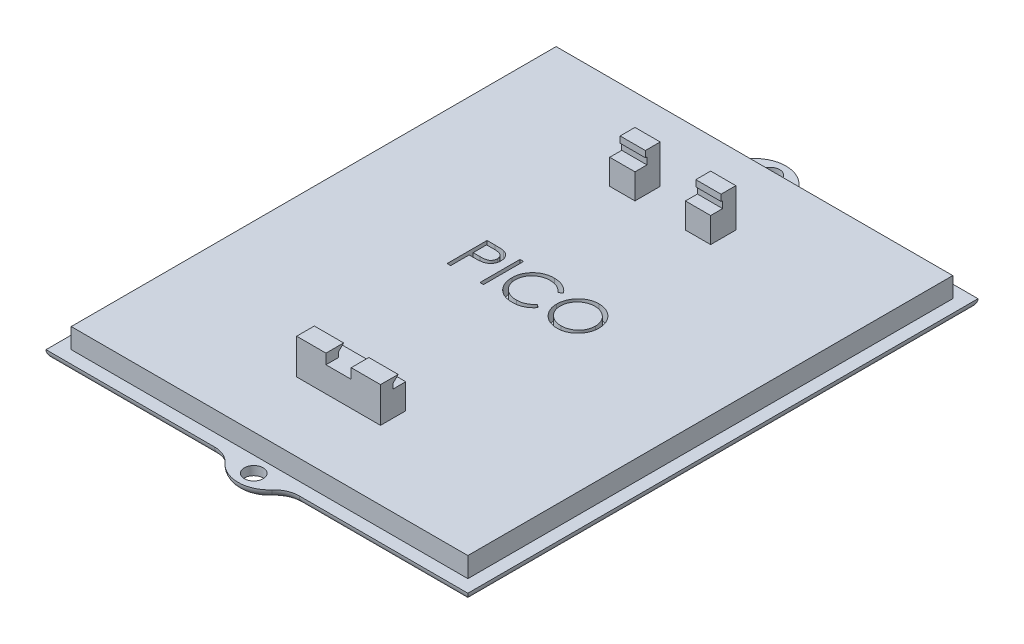
from build123d import *

# Parameters (mm, degrees)
SKETCH1_W            = 62.9
SKETCH1_H            = 76.9
BOSS_EXTRUDE1_DEPTH  = 4.575
SKETCH11_W           = 66.9
SKETCH11_H           = 80.9
BOSS_EXTRUDE5_DEPTH  = 1.4
BOSS_EXTRUDE3_DEPTH  = 1.4
CUT_EXTRUDE3_REACH   = 56.926
SKETCH12_R           = 1.5
FILLET1_R            = 1.4
SKETCH15_W           = 13.3
SKETCH15_H           = 4
SKETCH15_W_2         = 4
BOSS_EXTRUDE7_DEPTH  = 4
SKETCH16_W           = 4.65
SKETCH16_H           = 2
BOSS_EXTRUDE8_DEPTH  = 0.8
BOSS_EXTRUDE9_DEPTH  = 4.65
SKETCH18_W           = 4
SKETCH18_H           = 2.1
BOSS_EXTRUDE10_DEPTH = 1.1
SKETCH5_W            = 0.569871795
SKETCH5_H            = 6.35
LETTERS_DEPTH        = 2
SKETCH21_W           = 4
SKETCH21_H           = 2.35
BOSS_EXTRUDE11_DEPTH = 1


with BuildPart() as part:
    # Sketch1 → Boss-Extrude1 (new body)
    with BuildSketch(Plane(origin=(0, 0, 0), x_dir=(1, 0, 0), z_dir=(0, 1, 0))):
        Rectangle(SKETCH1_W, SKETCH1_H)
    extrude(amount=BOSS_EXTRUDE1_DEPTH)

    # Sketch11 → Boss-Extrude5 (add)
    with BuildSketch(Plane(origin=(0, 0, 0), x_dir=(-1, 0, 0), z_dir=(0, -1, 0))):
        Rectangle(SKETCH11_W, SKETCH11_H)
    extrude(amount=-BOSS_EXTRUDE5_DEPTH)

    # Sketch4 → Boss-Extrude3 (add)
    with BuildSketch(Plane(origin=(0, 0, 0), x_dir=(1, 0, 0), z_dir=(0, 1, 0))):
        with BuildLine():
            Line((-6.708203932, -40.45), (6.708203932, -40.45))
            ThreePointArc((6.708203932, -40.45), (5.075210771, -40.798516283), (3.726779962, -41.783333333))
            ThreePointArc((3.726779962, -41.783333333), (0, -43.45), (-3.726779962, -41.783333333))
            ThreePointArc((-3.726779962, -41.783333333), (-5.075210771, -40.798516283), (-6.708203932, -40.45))
        make_face()
    boss_extrude3 = extrude(amount=BOSS_EXTRUDE3_DEPTH)

    # Sketch12 → Cut-Extrude3 (cut, up to next)
    with BuildSketch(Plane(origin=(0, 1.4, 0), x_dir=(1, 0, 0), z_dir=(0, 1, 0)), mode=Mode.PRIVATE) as cut_extrude3_sk1:
        with Locations(Location((0, -40.95, 0), (0, 0, 270))):
            Circle(SKETCH12_R)
    cut_extrude3_tool1 = extrude(cut_extrude3_sk1.sketch, amount=-CUT_EXTRUDE3_REACH, mode=Mode.PRIVATE) & part.part
    cut_extrude3 = cut_extrude3_tool1.solids().sort_by_distance((0, 1.4, 40.95))[0]
    add(cut_extrude3, mode=Mode.SUBTRACT)

    # Mirror1: Boss-Extrude3, Cut-Extrude3 across plane
    add(boss_extrude3.mirror(Plane.XY))
    add(cut_extrude3.mirror(Plane.XY), mode=Mode.SUBTRACT)

    # Fillet1
    # the kernel refuses this fillet: 1.4 mm, written as the material it takes off along each edge
    with BuildSketch(Plane(origin=(6.708203932, 0, -40.45), x_dir=(0, 0, 1), z_dir=(1, 0, 0)), Plane(origin=(-36.95, 0, -40.45), x_dir=(0, 0, 1), z_dir=(1, 0, 0)), Plane(origin=(-6.708203932, 0, 40.45), x_dir=(0, 0, -1), z_dir=(-1, 0, 0)), Plane(origin=(36.95, 0, 40.45), x_dir=(0, 0, -1), z_dir=(-1, 0, 0))) as fillet1_piece_1:
        with BuildLine():
            CenterArc((FILLET1_R, -FILLET1_R), FILLET1_R, 90, 90)
            Line((0, -FILLET1_R), (0, 0))
            Line((0, 0), (FILLET1_R, 0))
        make_face()
    extrude(amount=30.241796068, mode=Mode.SUBTRACT)
    with BuildSketch(Plane(origin=(6.708203932, 0, -44.45), x_dir=(0, 0, 1), z_dir=(1, 0, 0))) as fillet1_piece_2:
        with BuildLine():
            CenterArc((4 + FILLET1_R, -FILLET1_R), FILLET1_R, 90, 90)
            Line((4, -FILLET1_R), (4, 0))
            Line((4, 0), (4 + FILLET1_R, 0))
        make_face()
    revolve(axis=Axis((6.708203932, 0, -44.45), (0, -1, 0)), revolution_arc=48.189685104, mode=Mode.SUBTRACT)
    with BuildSketch(Plane(origin=(0, 0, -38.45), x_dir=(0.7453559924999297, 0, -0.6666666666666671), z_dir=(0.6666666666666671, 0, 0.7453559924999297))) as fillet1_piece_3:
        with BuildLine():
            CenterArc((5 - FILLET1_R, FILLET1_R), FILLET1_R, 270, 90)
            Line((5, FILLET1_R), (5, 0))
            Line((5, 0), (5 - FILLET1_R, 0))
        make_face()
    revolve(axis=Axis((0, 0, -38.45), (0, 1, 0)), revolution_arc=96.379370208, mode=Mode.SUBTRACT)
    with BuildSketch(Plane(origin=(-6.708203932, 0, -44.45), x_dir=(0.7453559924999316, 0, 0.666666666666665), z_dir=(0.666666666666665, 0, -0.7453559924999316))) as fillet1_piece_4:
        with BuildLine():
            CenterArc((4 + FILLET1_R, -FILLET1_R), FILLET1_R, 90, 90)
            Line((4, -FILLET1_R), (4, 0))
            Line((4, 0), (4 + FILLET1_R, 0))
        make_face()
    revolve(axis=Axis((-6.708203932, 0, -44.45), (0, -1, 0)), revolution_arc=48.189685104, mode=Mode.SUBTRACT)
    with BuildSketch(Plane(origin=(-33.45, 0, 43.95), x_dir=(1, 0, 0), z_dir=(0, 0, -1)), Plane(origin=(33.45, 0, -43.95), x_dir=(-1, 0, 0), z_dir=(0, 0, 1))) as fillet1_piece_5:
        with BuildLine():
            CenterArc((FILLET1_R, -FILLET1_R), FILLET1_R, 90, 90)
            Line((0, -FILLET1_R), (0, 0))
            Line((0, 0), (FILLET1_R, 0))
        make_face()
    extrude(amount=87.9, mode=Mode.SUBTRACT)
    with BuildSketch(Plane(origin=(-6.708203932, 0, 44.45), x_dir=(0.7453559924999316, 0, -0.666666666666665), z_dir=(0.666666666666665, 0, 0.7453559924999316))) as fillet1_piece_6:
        with BuildLine():
            CenterArc((4 + FILLET1_R, FILLET1_R), FILLET1_R, 180, 90)
            Line((4, FILLET1_R), (4, 0))
            Line((4, 0), (4 + FILLET1_R, 0))
        make_face()
    revolve(axis=Axis((-6.708203932, 0, 44.45), (0, 1, 0)), revolution_arc=48.189685104, mode=Mode.SUBTRACT)
    with BuildSketch(Plane(origin=(0, 0, 38.45), x_dir=(0.7453559924999297, 0, 0.6666666666666671), z_dir=(0.6666666666666671, 0, -0.7453559924999297))) as fillet1_piece_7:
        with BuildLine():
            CenterArc((5 - FILLET1_R, -FILLET1_R), FILLET1_R, 0, 90)
            Line((5, -FILLET1_R), (5, 0))
            Line((5, 0), (5 - FILLET1_R, 0))
        make_face()
    revolve(axis=Axis((0, 0, 38.45), (0, -1, 0)), revolution_arc=96.379370208, mode=Mode.SUBTRACT)
    with BuildSketch(Plane(origin=(6.708203932, 0, 44.45), x_dir=(0, 0, -1), z_dir=(1, 0, 0))) as fillet1_piece_8:
        with BuildLine():
            CenterArc((4 + FILLET1_R, FILLET1_R), FILLET1_R, 180, 90)
            Line((4, FILLET1_R), (4, 0))
            Line((4, 0), (4 + FILLET1_R, 0))
        make_face()
    revolve(axis=Axis((6.708203932, 0, 44.45), (0, 1, 0)), revolution_arc=48.189685104, mode=Mode.SUBTRACT)

    # Sketch15 → Boss-Extrude7 (add)
    with BuildSketch(Plane(origin=(0, 4.575, 0), x_dir=(1, 0, 0), z_dir=(0, 1, 0))):
        with Locations((0, -25.5)):
            Rectangle(SKETCH15_W, SKETCH15_H)
        with Locations((-6, 25.5)):
            Rectangle(SKETCH15_W_2, SKETCH15_H)
        with Locations((6, 25.5)):
            Rectangle(SKETCH15_W_2, SKETCH15_H)
    extrude(amount=BOSS_EXTRUDE7_DEPTH)

    # Sketch16 → Boss-Extrude8 (add)
    with BuildSketch(Plane(origin=(0, 8.575, 0), x_dir=(1, 0, 0), z_dir=(0, 1, 0))):
        with Locations((-4.325, -26.5)):
            Rectangle(SKETCH16_W, SKETCH16_H)
    boss_extrude8 = extrude(amount=BOSS_EXTRUDE8_DEPTH)

    # Sketch17 → Boss-Extrude9 (add)
    with BuildSketch(Plane.ZY.offset(6.65)):
        Polygon((27.5, 9.375), (27.5, 10.175), (24.7, 10.175), (25.5, 9.375), align=None)
    boss_extrude9 = extrude(amount=-BOSS_EXTRUDE9_DEPTH)

    # Mirror4: Boss-Extrude8, Boss-Extrude9 across plane
    add(boss_extrude8.mirror(Plane(origin=(0, 0, 0), x_dir=(0, 0, 1), z_dir=(1, 0, 0))))
    add(boss_extrude9.mirror(Plane(origin=(0, 0, 0), x_dir=(0, 0, 1), z_dir=(1, 0, 0))))

    # Sketch18 → Boss-Extrude10 (add)
    with BuildSketch(Plane(origin=(0, 8.575, 0), x_dir=(1, 0, 0), z_dir=(0, 1, 0))):
        with Locations((6, 26.45)):
            Rectangle(SKETCH18_W, SKETCH18_H)
        with Locations((-6, 26.45)):
            Rectangle(SKETCH18_W, SKETCH18_H)
    extrude(amount=BOSS_EXTRUDE10_DEPTH)

    # Sketch5 → Letters (cut)
    # profile 1 of 4: a face of its own
    with BuildSketch(Plane(origin=(0, 4.575, 0), x_dir=(1, 0, 0), z_dir=(0, 1, 0))):
        with BuildLine():
            Line((-10.298397436, 6.35), (-9.05307492, 6.35))
            add(Edge.make_bspline(
                [(-9.05307492, 6.35), (-8.967420847, 6.349905845), (-8.80330384, 6.349725441), (-8.567963668, 6.344255831), (-8.354223155, 6.336950261), (-8.162543178, 6.326823112), (-7.992333971, 6.314855012), (-7.844365728, 6.298069169), (-7.71747539, 6.280542633), (-7.641445117, 6.262723796), (-7.606770833, 6.254597356)],
                knots=[0, 0, 0, 0, 1.415646017, 2.712440637, 3.8905458, 4.950247383, 5.884950622, 6.709939814, 7.411656543, 8, 8, 8, 8], degree=3))
            add(Edge.make_bspline(
                [(-7.606770833, 6.254597356), (-7.562876851, 6.242583247), (-7.476123192, 6.218838126), (-7.351117014, 6.171278942), (-7.232183608, 6.114887014), (-7.118914924, 6.050617866), (-7.012702859, 5.975714057), (-6.911962756, 5.893211922), (-6.817583649, 5.801206647), (-6.730096266, 5.700730162), (-6.649750991, 5.59346921), (-6.580572852, 5.477822593), (-6.52264774, 5.355736942), (-6.472966662, 5.227297177), (-6.437209895, 5.091424733), (-6.410273376, 4.949063698), (-6.393176224, 4.800229332), (-6.391538719, 4.698520715), (-6.390705128, 4.646744792)],
                knots=[0, 0, 0, 0, 0.999701418, 1.975846123, 2.934577507, 3.890451536, 4.834027766, 5.787354733, 6.749476667, 7.726910423, 8.712836071, 9.690891519, 10.682875813, 11.679750201, 12.712814741, 13.765529915, 14.8625177, 16, 16, 16, 16], degree=3))
            add(Edge.make_bspline(
                [(-6.390705128, 4.646744792), (-6.391469713, 4.594533682), (-6.392965675, 4.492379121), (-6.410920364, 4.342931348), (-6.43510514, 4.200113697), (-6.47229265, 4.064242837), (-6.520998371, 3.936125653), (-6.578133952, 3.813804275), (-6.647046929, 3.699359728), (-6.72623112, 3.592376529), (-6.814317584, 3.492754259), (-6.910933629, 3.401214846), (-7.015689202, 3.318294118), (-7.128251385, 3.24380618), (-7.24971754, 3.179478359), (-7.378245447, 3.121861534), (-7.514952268, 3.07347261), (-7.609553686, 3.04801807), (-7.657652244, 3.035076122)],
                knots=[0, 0, 0, 0, 1.121902311, 2.195077645, 3.232258892, 4.234102512, 5.217864754, 6.176164875, 7.132989551, 8.084763148, 9.034132444, 9.988522005, 10.94243251, 11.903244335, 12.886203696, 13.894208494, 14.929344452, 16, 16, 16, 16], degree=3))
            add(Edge.make_bspline(
                [(-7.657652244, 3.035076122), (-7.697434692, 3.026616142), (-7.784620242, 3.008075604), (-7.928207752, 2.987377404), (-8.09538581, 2.969710614), (-8.285926232, 2.956464264), (-8.499657988, 2.94512431), (-8.736696698, 2.936110768), (-8.997507666, 2.931158033), (-9.179428352, 2.930902595), (-9.274409054, 2.930769231)],
                knots=[0, 0, 0, 0, 0.601384939, 1.31797006, 2.144135048, 3.087295005, 4.142315834, 5.309527816, 6.595305764, 8, 8, 8, 8], degree=3))
            Line((-9.274409054, 2.930769231), (-9.728525641, 2.930769231))
            Line((-9.728525641, 2.930769231), (-9.728525641, 0))
            Line((-9.728525641, 0), (-10.298397436, 0))
            Line((-10.298397436, 0), (-10.298397436, 6.35))
        make_face()
        with BuildLine():
            Line((-9.728525641, 5.698717949), (-9.728525641, 3.582051282))
            Line((-9.728525641, 3.582051282), (-8.616766827, 3.568058894))
            add(Edge.make_bspline(
                [(-8.616766827, 3.568058894), (-8.562483533, 3.568030839), (-8.457690753, 3.567976679), (-8.306313605, 3.575207013), (-8.165871041, 3.583553693), (-8.036794454, 3.595774583), (-7.919025659, 3.613048864), (-7.812368285, 3.630487303), (-7.717649358, 3.655715604), (-7.606797949, 3.689684601), (-7.483275304, 3.747619489), (-7.348895609, 3.831711433), (-7.235011831, 3.938900717), (-7.136462921, 4.059419783), (-7.058256542, 4.193493918), (-7.001004956, 4.33694756), (-6.967365999, 4.488309516), (-6.962855334, 4.59188371), (-6.960576923, 4.644200721)],
                knots=[0, 0, 0, 0, 1.160613943, 2.240541288, 3.23993089, 4.169200891, 5.011653406, 5.7853311, 6.478053781, 7.106038997, 8.262395093, 9.384106736, 10.481365981, 11.59014053, 12.70357646, 13.786202915, 14.881775077, 16, 16, 16, 16], degree=3))
            add(Edge.make_bspline(
                [(-6.960576923, 4.644200721), (-6.962867725, 4.695252024), (-6.967421554, 4.796735696), (-7.00126862, 4.94546859), (-7.058145233, 5.087410511), (-7.136987911, 5.219804537), (-7.23267539, 5.339889939), (-7.343889913, 5.444206155), (-7.470369687, 5.52806553), (-7.588022906, 5.582191627), (-7.692527915, 5.615239341), (-7.783300185, 5.638362123), (-7.885790409, 5.65682358), (-8.000031951, 5.671772392), (-8.12513935, 5.684569386), (-8.262187436, 5.693252516), (-8.410657045, 5.698335158), (-8.513727653, 5.698587263), (-8.567157452, 5.698717949)],
                knots=[0, 0, 0, 0, 1.120700087, 2.227813068, 3.331159281, 4.466773991, 5.599788987, 6.693661531, 7.80175334, 8.91857717, 9.525282508, 10.207424825, 10.974604443, 11.810962634, 12.737642355, 13.736264703, 14.826523623, 16, 16, 16, 16], degree=3))
            Line((-8.567157452, 5.698717949), (-9.728525641, 5.698717949))
        make_face(mode=Mode.SUBTRACT)
    # profile 2 of 4: a face of its own
    with BuildSketch(Plane(origin=(0, 4.575, 0), x_dir=(1, 0, 0), z_dir=(0, 1, 0))):
        with Locations((-4.803205129, 3.175)):
            Rectangle(SKETCH5_W, SKETCH5_H)
    # profile 3 of 4: a face of its own
    with BuildSketch(Plane(origin=(0, 4.575, 0), x_dir=(1, 0, 0), z_dir=(0, 1, 0))):
        with BuildLine():
            Line((2.971474359, 5.184815705), (2.472836538, 4.803205128))
            add(Edge.make_bspline(
                [(2.472836538, 4.803205128), (2.437265855, 4.845597673), (2.366604059, 4.929811221), (2.252922363, 5.048065537), (2.134446525, 5.158855368), (2.011221834, 5.262708493), (1.881030288, 5.355993196), (1.747025697, 5.443570769), (1.606966386, 5.522070808), (1.413288239, 5.617253654), (1.159927143, 5.716578821), (0.840985077, 5.799860398), (0.508043513, 5.852875959), (0.280899297, 5.858617886), (0.165364583, 5.861538462)],
                knots=[0, 0, 0, 0, 0.757959112, 1.505699292, 2.245454638, 2.979532153, 3.711538275, 4.438200793, 5.171680507, 5.909471876, 7.393775596, 8.890124382, 10.418191784, 12, 12, 12, 12], degree=3))
            add(Edge.make_bspline(
                [(0.165364583, 5.861538462), (0.101713455, 5.860805558), (-0.024998061, 5.859346553), (-0.213046005, 5.840098569), (-0.397582541, 5.813045374), (-0.57848763, 5.772903716), (-0.755530997, 5.722153393), (-0.92987007, 5.661510142), (-1.098980729, 5.586480646), (-1.26520239, 5.503552803), (-1.424458959, 5.409885868), (-1.575144545, 5.307717358), (-1.716709573, 5.198190569), (-1.849266026, 5.08089499), (-1.972949418, 4.956358862), (-2.086863539, 4.823254985), (-2.190614212, 4.682008899), (-2.286257958, 4.534483145), (-2.371915345, 4.381107437), (-2.443633841, 4.221314095), (-2.507143134, 4.057839508), (-2.557397474, 3.888836688), (-2.597174812, 3.715494813), (-2.624620715, 3.537348669), (-2.643649799, 3.354770422), (-2.645101548, 3.23101924), (-2.645833333, 3.168639824)],
                knots=[0, 0, 0, 0, 1.054917814, 2.100044995, 3.131103042, 4.146048494, 5.169673617, 6.183595914, 7.203665975, 8.234915748, 9.262203917, 10.264457458, 11.251630812, 12.227803204, 13.197192746, 14.159520551, 15.12972552, 16.100847026, 17.073214652, 18.039054194, 19.002613845, 19.979014051, 20.95965708, 21.949030935, 22.966165397, 24, 24, 24, 24], degree=3))
            add(Edge.make_bspline(
                [(-2.645833333, 3.168639824), (-2.643544033, 3.074784429), (-2.639049296, 2.890511811), (-2.599047318, 2.620599417), (-2.53825951, 2.362026195), (-2.447154106, 2.116408481), (-2.334815257, 1.880717603), (-2.192864433, 1.658941397), (-2.028460144, 1.447728487), (-1.839276554, 1.252070568), (-1.631711717, 1.073338524), (-1.409011934, 0.915948183), (-1.171731869, 0.784748325), (-0.922491412, 0.675571964), (-0.659372605, 0.591649044), (-0.382848606, 0.53256842), (-0.093520844, 0.494029036), (0.104180782, 0.490339344), (0.204797676, 0.488461538)],
                knots=[0, 0, 0, 0, 1.029171465, 2.020641659, 2.987623507, 3.938342917, 4.889210282, 5.84687017, 6.821220943, 7.821438502, 8.827599549, 9.822697543, 10.807740252, 11.797342354, 12.80366471, 13.83203677, 14.896651826, 16, 16, 16, 16], degree=3))
            add(Edge.make_bspline(
                [(0.204797676, 0.488461538), (0.315655412, 0.491525467), (0.533849955, 0.497556013), (0.853831946, 0.548644936), (1.160148264, 0.631481444), (1.452815385, 0.747410532), (1.731008243, 0.898114697), (1.995162184, 1.080809417), (2.245500176, 1.297232535), (2.396033788, 1.462483354), (2.472836538, 1.546794872)],
                knots=[0, 0, 0, 0, 1.028121516, 2.023589091, 2.998037872, 3.967518031, 4.937445131, 5.927275754, 6.942489185, 8, 8, 8, 8], degree=3))
            Line((2.472836538, 1.546794872), (2.971474359, 1.169000401))
            add(Edge.make_bspline(
                [(2.971474359, 1.169000401), (2.931345788, 1.117223495), (2.85128086, 1.013917692), (2.721635601, 0.868281876), (2.585061076, 0.731295983), (2.440542859, 0.604064442), (2.289743437, 0.48404134), (2.129955099, 0.374636589), (1.963278426, 0.274323127), (1.790278157, 0.182471421), (1.611138102, 0.100978702), (1.426072913, 0.03121258), (1.235880297, -0.028885434), (1.040551561, -0.078328233), (0.839681545, -0.116920057), (0.633995113, -0.14271861), (0.42304834, -0.160393226), (0.28073319, -0.162004159), (0.208613782, -0.162820513)],
                knots=[0, 0, 0, 0, 0.986787822, 1.968848986, 2.935600012, 3.899624008, 4.868462664, 5.837806735, 6.815139263, 7.798259679, 8.787526145, 9.778297419, 10.776456485, 11.791383307, 12.812564526, 13.85620153, 14.913611965, 16, 16, 16, 16], degree=3))
            add(Edge.make_bspline(
                [(0.208613782, -0.162820513), (0.140317415, -0.162345183), (0.005269805, -0.161405279), (-0.19411793, -0.146179489), (-0.388227598, -0.125406395), (-0.576504419, -0.094127871), (-0.759975831, -0.057217426), (-0.936978605, -0.007739575), (-1.109254487, 0.047685342), (-1.276111334, 0.112827246), (-1.437691075, 0.186335178), (-1.593472561, 0.269414149), (-1.743384146, 0.361365532), (-1.888899695, 0.460162479), (-2.027869597, 0.568978441), (-2.161498136, 0.686302192), (-2.290534628, 0.811738298), (-2.370368071, 0.902189246), (-2.410506811, 0.947666266)],
                knots=[0, 0, 0, 0, 1.114604814, 2.203992996, 3.262667896, 4.300477797, 5.318619304, 6.316056647, 7.298880507, 8.271930387, 9.238335007, 10.195173496, 11.151986948, 12.108099108, 13.064862484, 14.031167946, 15.010108607, 16, 16, 16, 16], degree=3))
            add(Edge.make_bspline(
                [(-2.410506811, 0.947666266), (-2.474797193, 1.026662423), (-2.602601786, 1.183701026), (-2.766115527, 1.438219878), (-2.906083234, 1.703955057), (-3.019250976, 1.982302642), (-3.107720506, 2.272638045), (-3.169009246, 2.575107621), (-3.208835728, 2.889428887), (-3.213390109, 3.10321849), (-3.215705128, 3.211889022)],
                knots=[0, 0, 0, 0, 0.994628077, 1.977248131, 2.950237994, 3.925870899, 4.908910175, 5.911660606, 6.938484602, 8, 8, 8, 8], degree=3))
            add(Edge.make_bspline(
                [(-3.215705128, 3.211889022), (-3.212883563, 3.326108202), (-3.207332309, 3.550827308), (-3.160168509, 3.880617195), (-3.084297264, 4.19657759), (-2.976534338, 4.49811867), (-2.839908914, 4.786826464), (-2.671132058, 5.060495507), (-2.472164528, 5.320875986), (-2.244566799, 5.564017035), (-1.994980347, 5.786338432), (-1.727701928, 5.981929687), (-1.443254681, 6.144702895), (-1.144772293, 6.280767361), (-0.830019699, 6.385350887), (-0.499668444, 6.458563097), (-0.15433927, 6.504132722), (0.081268274, 6.509893457), (0.200981571, 6.512820513)],
                knots=[0, 0, 0, 0, 1.032925535, 2.032216505, 3.007276963, 3.968222605, 4.92396291, 5.891752235, 6.871517503, 7.883894988, 8.900124299, 9.891468569, 10.874487609, 11.85992873, 12.854644235, 13.869047385, 14.917252991, 16, 16, 16, 16], degree=3))
            add(Edge.make_bspline(
                [(0.200981571, 6.512820513), (0.273942112, 6.511945776), (0.418360158, 6.510214324), (0.631997113, 6.493330323), (0.839991049, 6.465184209), (1.042485259, 6.426873625), (1.240464863, 6.379326056), (1.432416728, 6.317385801), (1.619467203, 6.246562379), (1.800436594, 6.164994877), (1.97445662, 6.073433789), (2.141473084, 5.972894015), (2.300159327, 5.863500196), (2.451631952, 5.746182721), (2.593357078, 5.61845962), (2.729358618, 5.483843982), (2.855018003, 5.33845833), (2.932584513, 5.236123664), (2.971474359, 5.184815705)],
                knots=[0, 0, 0, 0, 1.096760587, 2.17092713, 3.219439832, 4.250915756, 5.268269357, 6.278326846, 7.281116186, 8.274029601, 9.260640565, 10.235837813, 11.203064059, 12.156899882, 13.114053108, 14.069676657, 15.032185724, 16, 16, 16, 16], degree=3))
        make_face()
    # profile 4 of 4: a face of its own
    with BuildSketch(Plane(origin=(0, 4.575, 0), x_dir=(1, 0, 0), z_dir=(0, 1, 0))):
        with BuildLine():
            add(Edge.make_bspline(
                [(7.245512821, 6.512820513), (7.363093241, 6.5098424), (7.594030888, 6.503993141), (7.933438203, 6.459218196), (8.257460733, 6.38175656), (8.568737985, 6.278590864), (8.863546671, 6.140969336), (9.144105804, 5.974626281), (9.409747847, 5.777818991), (9.656892353, 5.552068823), (9.883055677, 5.306444556), (10.082311214, 5.044320348), (10.249302233, 4.767281093), (10.386436446, 4.4761593), (10.494021067, 4.171613358), (10.568259903, 3.852019667), (10.615681976, 3.519448958), (10.621226029, 3.292614503), (10.624038462, 3.177544071)],
                knots=[0, 0, 0, 0, 1.065120563, 2.091984664, 3.0946048, 4.079830382, 5.057816894, 6.036188127, 7.030412546, 8.04752943, 9.064399622, 10.05169764, 11.02544977, 11.989514704, 12.962713494, 13.945757189, 14.957906945, 16, 16, 16, 16], degree=3))
            add(Edge.make_bspline(
                [(10.624038462, 3.177544071), (10.621226441, 3.063321275), (10.615683623, 2.838174912), (10.568205984, 2.507714663), (10.493745884, 2.190050114), (10.387435515, 1.885711573), (10.250955004, 1.594377993), (10.082852051, 1.316815948), (9.884838711, 1.052934444), (9.659491996, 0.805624322), (9.41383582, 0.578843197), (9.150346621, 0.381233237), (8.87495017, 0.211190896), (8.584102556, 0.075511945), (8.281661061, -0.032931396), (7.964918846, -0.106868311), (7.635360098, -0.154560518), (7.410622705, -0.160036968), (7.296394231, -0.162820513)],
                knots=[0, 0, 0, 0, 1.043624062, 2.057103931, 3.04512605, 4.022047818, 4.998200453, 5.980619268, 6.982898556, 8.009068085, 9.034988726, 10.034168286, 11.015286542, 11.987931943, 12.962482838, 13.94673481, 14.956375938, 16, 16, 16, 16], degree=3))
            add(Edge.make_bspline(
                [(7.296394231, -0.162820513), (7.181324395, -0.160009482), (6.954491117, -0.154468193), (6.621502496, -0.106967644), (6.301684304, -0.032688422), (5.995951124, 0.073464412), (5.704132466, 0.210655674), (5.425657601, 0.377940762), (5.161644291, 0.576436575), (4.914281408, 0.801710217), (4.68795072, 1.046950033), (4.490630139, 1.309720753), (4.323307433, 1.584867082), (4.186576816, 1.87315259), (4.078328439, 2.173183636), (4.004478269, 2.486961588), (3.956697328, 2.812697548), (3.951191249, 3.034481092), (3.948397436, 3.147015224)],
                knots=[0, 0, 0, 0, 1.053102029, 2.075944431, 3.073151272, 4.055350789, 5.033113405, 6.020478099, 7.024410459, 8.052272461, 9.079885166, 10.07527673, 11.055994387, 12.023226415, 12.992069828, 13.970394897, 14.97016774, 16, 16, 16, 16], degree=3))
            add(Edge.make_bspline(
                [(3.948397436, 3.147015224), (3.949367417, 3.222548781), (3.951295144, 3.372663005), (3.974502929, 3.595578123), (4.008179158, 3.814908316), (4.056442628, 4.030029893), (4.119564652, 4.240416251), (4.194044759, 4.447518349), (4.285012764, 4.649237391), (4.387847654, 4.846528973), (4.502622649, 5.036317602), (4.629397223, 5.215713417), (4.763718534, 5.386221797), (4.91097212, 5.543424219), (5.066304813, 5.691893852), (5.232236442, 5.829349067), (5.407754514, 5.957029336), (5.59361426, 6.072091954), (5.785235988, 6.176157813), (5.98276957, 6.265460314), (6.183532207, 6.34210674), (6.388464211, 6.40422938), (6.597021383, 6.453273217), (6.809658907, 6.486669416), (7.02620738, 6.509936392), (7.172096487, 6.511855003), (7.245512821, 6.512820513)],
                knots=[0, 0, 0, 0, 1.037015668, 2.060948919, 3.074880161, 4.083647147, 5.086022904, 6.090072063, 7.104153813, 8.122640571, 9.144368836, 10.147691507, 11.138137339, 12.123020368, 13.103399296, 14.087645067, 15.080126199, 16.082011238, 17.087798457, 18.072939717, 19.057185487, 20.037253025, 21.01195951, 21.997135196, 22.992090687, 24, 24, 24, 24], degree=3))
        make_face()
        with BuildLine():
            add(Edge.make_bspline(
                [(7.273497596, 5.861538462), (7.213236761, 5.860803875), (7.093291188, 5.859341724), (6.914974958, 5.840081783), (6.739003878, 5.812631842), (6.565341607, 5.773476797), (6.394714768, 5.720129444), (6.225532913, 5.658732368), (6.059338801, 5.583945532), (5.896681087, 5.49944934), (5.738992308, 5.405924869), (5.590197836, 5.302561806), (5.449912467, 5.191784144), (5.318479684, 5.073333353), (5.196285414, 4.946606218), (5.080924599, 4.813523941), (4.977021215, 4.670282653), (4.881797382, 4.520766629), (4.796584301, 4.365170618), (4.720810014, 4.205132725), (4.658826741, 4.039347493), (4.60827643, 3.869613521), (4.566366773, 3.69619963), (4.539816654, 3.517790305), (4.520345087, 3.33528203), (4.518966511, 3.211943523), (4.518269231, 3.149559295)],
                knots=[0, 0, 0, 0, 1.008559885, 2.007477868, 2.99961109, 3.989939068, 4.984837346, 5.991145699, 7.001802488, 8.033829008, 9.059044045, 10.069351652, 11.065060232, 12.050310815, 13.029377138, 14.011219647, 14.996725999, 15.989392538, 16.977580475, 17.965360261, 18.951710183, 19.937753436, 20.929683414, 21.935841486, 22.955955122, 24, 24, 24, 24], degree=3))
            add(Edge.make_bspline(
                [(4.518269231, 3.149559295), (4.520582195, 3.05782498), (4.52513251, 2.877355204), (4.564969816, 2.612890143), (4.626332541, 2.358729966), (4.716788049, 2.116265359), (4.829909878, 1.88341216), (4.969658665, 1.662236027), (5.13522872, 1.452677184), (5.323303975, 1.256198625), (5.528903743, 1.076864094), (5.747221696, 0.919450481), (5.975918955, 0.786263314), (6.215591909, 0.677759825), (6.464961015, 0.591781301), (6.725633143, 0.532855784), (6.995871834, 0.494074601), (7.180077452, 0.490350315), (7.273497596, 0.488461538)],
                knots=[0, 0, 0, 0, 1.032063989, 2.030389145, 3.003944642, 3.970395727, 4.937377036, 5.913328081, 6.909231446, 7.93887556, 8.970685674, 9.976071282, 10.964166581, 11.944589148, 12.933237628, 13.927779006, 14.949070134, 16, 16, 16, 16], degree=3))
            add(Edge.make_bspline(
                [(7.273497596, 0.488461538), (7.336289121, 0.489324239), (7.460823572, 0.491035234), (7.64605402, 0.508268548), (7.827947433, 0.535903511), (8.006248683, 0.575691986), (8.180755412, 0.62548906), (8.352195984, 0.684648795), (8.518744311, 0.758456122), (8.682501445, 0.840004549), (8.839248912, 0.932968834), (8.988883092, 1.032823763), (9.12763237, 1.143438261), (9.258966828, 1.260129149), (9.381662778, 1.385249273), (9.494890506, 1.518635961), (9.598268746, 1.661131154), (9.693456419, 1.81042039), (9.77837091, 1.966442163), (9.852355847, 2.127060293), (9.915123086, 2.291879277), (9.965793373, 2.461136842), (10.005499854, 2.634511525), (10.032859137, 2.812235467), (10.051997018, 2.993953131), (10.053439516, 3.116859841), (10.054166667, 3.178816106)],
                knots=[0, 0, 0, 0, 1.047197238, 2.076906641, 3.100256066, 4.114471768, 5.12198147, 6.126382909, 7.136867548, 8.15857795, 9.17633901, 10.174870724, 11.156907918, 12.133735059, 13.104061851, 14.077631395, 15.04955518, 16.038496417, 17.029181396, 18.010275684, 18.986308667, 19.968651475, 20.955262928, 21.950658345, 22.966943676, 24, 24, 24, 24], degree=3))
            add(Edge.make_bspline(
                [(10.054166667, 3.178816106), (10.053438933, 3.240348521), (10.05199534, 3.3624094), (10.032868278, 3.542859742), (10.005470949, 3.719304854), (9.965987179, 3.89105204), (9.915096185, 4.058145078), (9.852344886, 4.220427035), (9.7783487, 4.378502474), (9.693425207, 4.531980699), (9.59796507, 4.679254866), (9.493654086, 4.820047815), (9.37869124, 4.951715503), (9.256361166, 5.077508448), (9.123608274, 5.194743762), (8.981033912, 5.303460335), (8.830368954, 5.406281847), (8.670843827, 5.499038223), (8.506208368, 5.584698331), (8.337273044, 5.658088008), (8.165951678, 5.720448853), (7.992679931, 5.773638204), (7.815999384, 5.812478488), (7.637103866, 5.840106521), (7.456240883, 5.859335021), (7.334605327, 5.860801651), (7.273497596, 5.861538462)],
                knots=[0, 0, 0, 0, 1.02996197, 2.043119294, 3.035359645, 4.018872909, 4.991431989, 5.957985074, 6.929999688, 7.912076566, 8.892894881, 9.867085534, 10.843653904, 11.817741046, 12.803660682, 13.806313499, 14.818574707, 15.856120519, 16.894564902, 17.924820532, 18.937903209, 19.946497019, 20.957711757, 21.963978472, 22.977135795, 24, 24, 24, 24], degree=3))
        make_face(mode=Mode.SUBTRACT)
    extrude(amount=-LETTERS_DEPTH, mode=Mode.SUBTRACT)

    # Sketch21 → Boss-Extrude11 (add)
    with BuildSketch(Plane(origin=(0, 9.675, 0), x_dir=(1, 0, 0), z_dir=(0, 1, 0))):
        with Locations((-6, 26.325)):
            Rectangle(SKETCH21_W, SKETCH21_H)
        with Locations((6, 26.325)):
            Rectangle(SKETCH21_W, SKETCH21_H)
    extrude(amount=BOSS_EXTRUDE11_DEPTH)


solid = part.part
